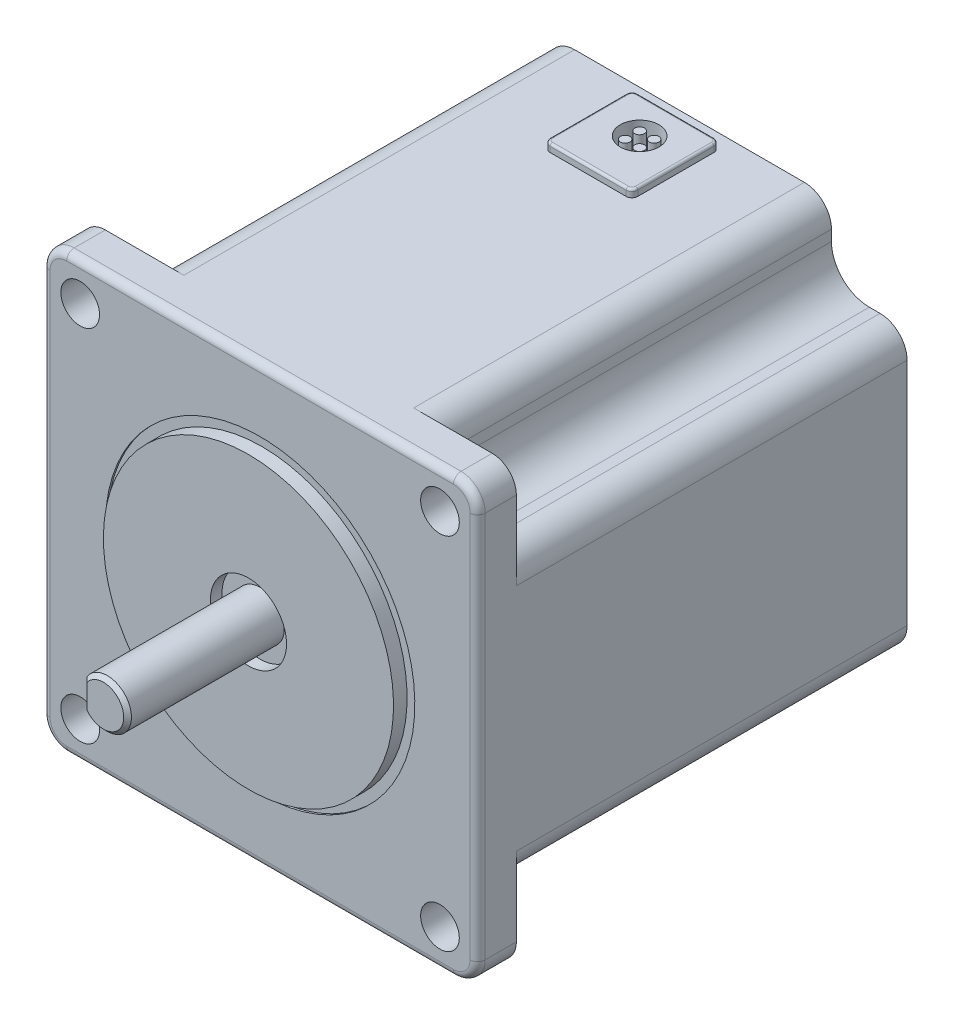
from build123d import *

# Parameters (mm, degrees)
BOSS_EXTRUDE1_DEPTH = 5.08
FILLET1_R           = 0.9906
BOSS_EXTRUDE2_DEPTH = 51.308
SKETCH5_W           = 1.524
SKETCH5_H           = 19.05
SKETCH6_W           = 0.254
SKETCH6_H           = 1.27
SKETCH7_W           = 76.962
SKETCH7_H           = 3.175
CUT_EXTRUDE1_START  = -14.986
CUT_EXTRUDE1_DEPTH  = 14.986
CHAMFER1_SIZE       = 0.508
SKETCH9_R           = 2.54
CUT_EXTRUDE2_DEPTH  = 5.08
CUT_EXTRUDE3_DEPTH  = 1.2954
SKETCH11_R          = 3.7465
SKETCH11_R_2        = 2.54
BOSS_EXTRUDE3_DEPTH = 1.2954
SKETCH12_W          = 11.5062
SKETCH12_H          = 11.5062
SKETCH12_R          = 2.54
BOSS_EXTRUDE4_DEPTH = 1.016
FILLET2_R           = 0.762
FILLET3_R           = 0.3048
SKETCH13_R          = 0.635
BOSS_EXTRUDE5_DEPTH = 1.9304


with BuildPart() as part:
    # Sketch3 → Boss-Extrude1 (new body)
    with BuildSketch(Plane.XY):
        with BuildLine():
            Line((-28.575, -25.4), (-28.575, 25.4))
            ThreePointArc((-28.575, 25.4), (-27.64506403, 27.64506403), (-25.4, 28.575))
            Line((-25.4, 28.575), (25.4, 28.575))
            ThreePointArc((25.4, 28.575), (27.64506403, 27.64506403), (28.575, 25.4))
            Line((28.575, 25.4), (28.575, -25.4))
            ThreePointArc((28.575, -25.4), (27.64506403, -27.64506403), (25.4, -28.575))
            Line((25.4, -28.575), (-25.4, -28.575))
            ThreePointArc((-25.4, -28.575), (-27.64506403, -27.64506403), (-28.575, -25.4))
        make_face()
    extrude(amount=-BOSS_EXTRUDE1_DEPTH)

    # Fillet1
    fillet1_edges = [part.edges().sort_by_distance(p)[0] for p in [
        (-28.575, 0, 0),
        (-27.64506403, 27.64506403, 0),
        (0, 28.575, 0),
        (27.64506403, 27.64506403, 0),
        (28.575, 0, 0),
        (27.64506403, -27.64506403, 0),
        (0, -28.575, 0),
        (-27.64506403, -27.64506403, 0),
    ]]
    fillet(fillet1_edges, radius=FILLET1_R)

    # Sketch4 → Boss-Extrude2 (add)
    with BuildSketch(Plane.XY.offset(-5.08)):
        with BuildLine():
            Line((-25.019, 18.6436), (-23.622, 18.6436))
            ThreePointArc((-23.622, 18.6436), (-20.101739601, 20.101739601), (-18.6436, 23.622))
            Line((-18.6436, 23.622), (-18.6436, 25.019))
            ThreePointArc((-18.6436, 25.019), (-17.602071714, 27.533471714), (-15.0876, 28.575))
            Line((-15.0876, 28.575), (15.0876, 28.575))
            ThreePointArc((15.0876, 28.575), (17.602071714, 27.533471714), (18.6436, 25.019))
            Line((18.6436, 25.019), (18.6436, 23.622))
            ThreePointArc((18.6436, 23.622), (20.101739601, 20.101739601), (23.622, 18.6436))
            Line((23.622, 18.6436), (25.019, 18.6436))
            ThreePointArc((25.019, 18.6436), (27.533471714, 17.602071714), (28.575, 15.0876))
            Line((28.575, 15.0876), (28.575, -15.0876))
            ThreePointArc((28.575, -15.0876), (27.533471714, -17.602071714), (25.019, -18.6436))
            Line((25.019, -18.6436), (23.622, -18.6436))
            ThreePointArc((23.622, -18.6436), (20.101739601, -20.101739601), (18.6436, -23.622))
            Line((18.6436, -23.622), (18.6436, -25.019))
            ThreePointArc((18.6436, -25.019), (17.602071714, -27.533471714), (15.0876, -28.575))
            Line((15.0876, -28.575), (-15.0876, -28.575))
            ThreePointArc((-15.0876, -28.575), (-17.602071714, -27.533471714), (-18.6436, -25.019))
            Line((-18.6436, -25.019), (-18.6436, -23.622))
            ThreePointArc((-18.6436, -23.622), (-20.101739601, -20.101739601), (-23.622, -18.6436))
            Line((-23.622, -18.6436), (-25.019, -18.6436))
            ThreePointArc((-25.019, -18.6436), (-27.533471714, -17.602071714), (-28.575, -15.0876))
            Line((-28.575, -15.0876), (-28.575, 15.0876))
            ThreePointArc((-28.575, 15.0876), (-27.533471714, 17.602071714), (-25.019, 18.6436))
        make_face()
    extrude(amount=-BOSS_EXTRUDE2_DEPTH)

    # Sketch5 → Revolve1 (revolve)
    with BuildSketch(Plane(origin=(0, 0, 0), x_dir=(0, 0, -1), z_dir=(1, 0, 0))):
        with Locations((-0.762, 9.525)):
            Rectangle(SKETCH5_W, SKETCH5_H)
    revolve(axis=Axis((0, 0, 0), (0, 0, 1)))

    # Sketch6 → Cut-Revolve1 (revolve, cut)
    with BuildSketch(Plane(origin=(0, 0, 0), x_dir=(0, 0, -1), z_dir=(1, 0, 0)), mode=Mode.PRIVATE) as cut_revolve1_sk:
        Polygon((56.388, 0), (-1.524, 0), (-1.524, 4.99999), (0, 4.99999), (0, 3.175), (56.388, 3.175), align=None)
        with Locations((0.127, 19.685)):
            Rectangle(SKETCH6_W, SKETCH6_H)
    revolve(cut_revolve1_sk.sketch.rotate(Axis((0, 0, 20.574), (0, 0, -1)), 180), axis=Axis((0, 0, 20.574), (0, 0, -1)), mode=Mode.SUBTRACT)

    # Sketch9 → Cut-Extrude2 (cut)
    with BuildSketch(Plane.XY):
        with Locations((23.622, -23.622)):
            Circle(SKETCH9_R)
        with Locations((-23.622, -23.622)):
            Circle(SKETCH9_R)
        with Locations((-23.622, 23.622)):
            Circle(SKETCH9_R)
        with Locations((23.622, 23.622)):
            Circle(SKETCH9_R)
    extrude(amount=-CUT_EXTRUDE2_DEPTH, mode=Mode.SUBTRACT)

    # Sketch10 → Cut-Extrude3 (cut)
    with BuildSketch(Plane(origin=(0, 28.575, -0.751200197), x_dir=(1, 0, 0), z_dir=(0, 1, 0))):
        with BuildLine():
            Line((-3.8354, 49.088679803), (-3.8354, 44.135679803))
            Line((-3.8354, 44.135679803), (3.8354, 44.135679803))
            Line((3.8354, 44.135679803), (3.8354, 49.088679803))
            ThreePointArc((3.8354, 49.088679803), (0, 52.924079803), (-3.8354, 49.088679803))
        make_face()
    extrude(amount=-CUT_EXTRUDE3_DEPTH, mode=Mode.SUBTRACT)

    # Sketch11 → Boss-Extrude3 (add)
    with BuildSketch(Plane(origin=(0, 27.2796, 0), x_dir=(1, 0, 0), z_dir=(0, 1, 0))):
        with Locations(Location((0, 49.83988, 0), (0, 0, 270))):
            Circle(SKETCH11_R)
        with Locations(Location((0, 49.83988, 0), (0, 0, 270))):
            Circle(SKETCH11_R_2, mode=Mode.SUBTRACT)
    extrude(amount=BOSS_EXTRUDE3_DEPTH)

    # Sketch12 → Boss-Extrude4 (add)
    with BuildSketch(Plane(origin=(0, 28.575, 0), x_dir=(1, 0, 0), z_dir=(0, 1, 0))):
        with Locations((0, 48.83658)):
            Rectangle(SKETCH12_W, SKETCH12_H)
        with Locations(Location((0, 49.83988, 0), (0, 0, 270))):
            Circle(SKETCH12_R, mode=Mode.SUBTRACT)
    extrude(amount=BOSS_EXTRUDE4_DEPTH)

    # Fillet2
    fillet2_edges = [part.edges().sort_by_distance(p)[0] for p in [
        (5.7531, 29.083, -43.08348),
        (5.7531, 29.083, -54.58968),
        (-5.7531, 29.083, -54.58968),
        (-5.7531, 29.083, -43.08348),
    ]]
    fillet(fillet2_edges, radius=FILLET2_R)

    # Fillet3
    fillet3_edges = [part.edges().sort_by_distance(p)[0] for p in [
        (0, 29.591, -54.58968),
        (5.7531, 29.591, -48.83658),
        (-5.7531, 29.591, -48.83658),
        (0, 29.591, -43.08348),
        (-5.529915367, 29.591, -43.306664633),
        (5.529915367, 29.591, -43.306664633),
        (-5.529915367, 29.591, -54.366495367),
        (5.529915367, 29.591, -54.366495367),
    ]]
    fillet(fillet3_edges, radius=FILLET3_R)

    # Sketch13 → Boss-Extrude5 (add)
    with BuildSketch(Plane(origin=(0, 27.2796, 0), x_dir=(1, 0, 0), z_dir=(0, 1, 0))):
        with Locations(Location((-0.9525, 50.79238, 0), (0, 0, 270))):
            Circle(SKETCH13_R)
        with Locations(Location((0.9525, 50.79238, 0), (0, 0, 270))):
            Circle(SKETCH13_R)
        with Locations(Location((0.9525, 48.88738, 0), (0, 0, 270))):
            Circle(SKETCH13_R)
        with Locations(Location((-0.9525, 48.88738, 0), (0, 0, 270))):
            Circle(SKETCH13_R)
    extrude(amount=BOSS_EXTRUDE5_DEPTH)


with BuildPart() as body_2:
    # Sketch7 → Revolve2 (revolve)
    with BuildSketch(Plane(origin=(0, 0, 0), x_dir=(0, 0, -1), z_dir=(1, 0, 0)), mode=Mode.PRIVATE) as revolve2_sk:
        with Locations((17.907, 1.5875)):
            Rectangle(SKETCH7_W, SKETCH7_H)
    revolve(revolve2_sk.sketch.rotate(Axis((0, 0, 20.574), (0, 0, -1)), 180), axis=Axis((0, 0, 20.574), (0, 0, -1)))

    # Sketch8 → Cut-Extrude1 (cut)
    with BuildSketch(Plane.XY.offset(20.574).offset(CUT_EXTRUDE1_START)):
        with BuildLine():
            Line((-2.667, -1.722711816), (-2.667, 1.722711816))
            ThreePointArc((-2.667, 1.722711816), (-3.175, 0), (-2.667, -1.722711816))
        make_face()
    extrude(amount=CUT_EXTRUDE1_DEPTH, mode=Mode.SUBTRACT)

    # Chamfer1
    chamfer1_edges = [body_2.edges().sort_by_distance(p)[0] for p in [
        (-2.667, 0, 20.574),
        (0, 3.175, -56.388),
        (2.78838977, 1.51838977, 20.574),
    ]]
    chamfer(chamfer1_edges, length=CHAMFER1_SIZE - 0.0001)  # a hair under: the kernel refuses the full size


solid = Compound([part.part, body_2.part])
